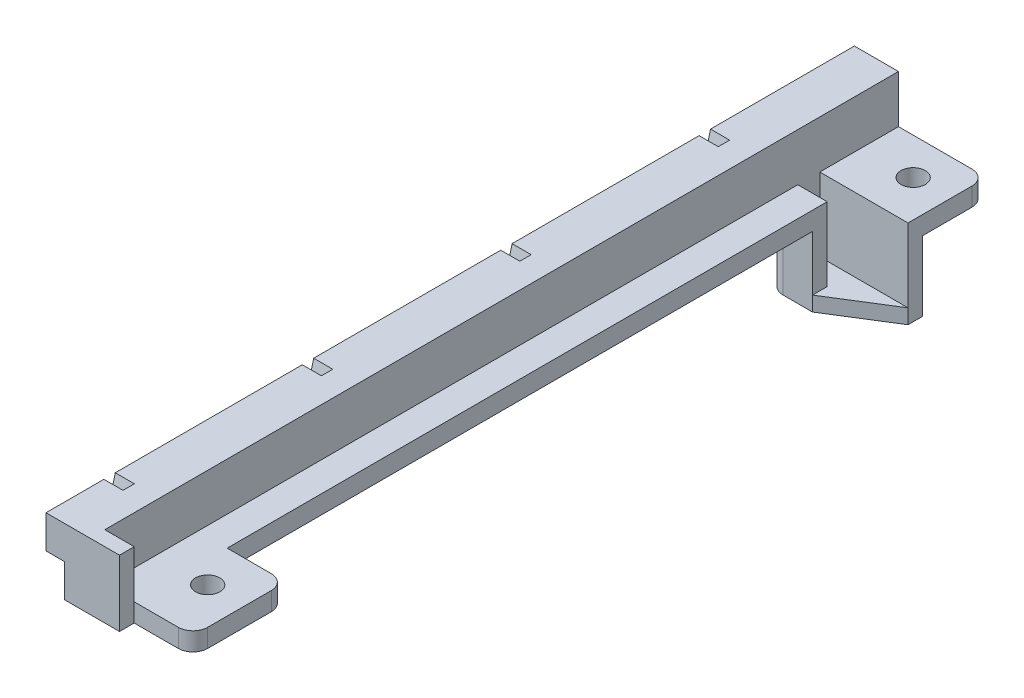
from build123d import *

# Parameters (mm, degrees)
SIDE_LIP_MAIN_SECTION_W          = 6
SIDE_LIP_MAIN_SECTION_H          = 108
SIDE_LIP_DEPTH                   = 5
VERTICAL_FIN_CUTS_DEPTH          = 2.6
SKETCH4_W                        = 3.5
SKETCH4_H                        = 108
DESCENDER_DEPTH                  = 4.5
SKETCH5_W                        = 108
SKETCH5_H                        = 2.5
PCB_BASE_DEPTH                   = 4
LOWER_CAP_DEPTH                  = 2
SKETCH9_W                        = 3
SKETCH9_H                        = 2.5
AL_BAR_CUT_DEPTH                 = 4
SKETCH10_W                       = 12.653731328
SKETCH10_H                       = 2.5
SKETCH10_W_2                     = 10.7
SUPPORT_TABS_DEPTH               = 8
BOLT_HOLES_REACH                 = 113.683
SKETCH11_R                       = 1.65
AL_BAR_ENCLOSURE_DEPTH           = 7.5
AL_BAR_BASE_DEPTH                = 2
FILLET1_R                        = 2
SKETCH16_W                       = 10
SKETCH16_H                       = 0.5
REDUCE_SIDE_SUPPORT_HEIGHT_DEPTH = 114.070774296


with BuildPart() as part:
    # Side lip main section → Side lip (new body)
    with BuildSketch(Plane(origin=(0, 0, 0), x_dir=(1, 0, 0), z_dir=(0, 1, 0))):
        with Locations((3, -54)):
            Rectangle(SIDE_LIP_MAIN_SECTION_W, SIDE_LIP_MAIN_SECTION_H)
    extrude(amount=-SIDE_LIP_DEPTH)

    # Sketch2 → Vertical fin cuts (cut)
    with BuildSketch(Plane.ZY):
        Polygon((102, 0), (103.246640014, -5), (101.70071957, -5), (100.454079556, 0), align=None)
        Polygon((75, 0), (76.246640014, -5), (74.70071957, -5), (73.454079556, 0), align=None)
        Polygon((48, 0), (49.246640014, -5), (47.70071957, -5), (46.454079556, 0), align=None)
        Polygon((21, 0), (22.246640014, -5), (20.70071957, -5), (19.454079556, 0), align=None)
    extrude(amount=-VERTICAL_FIN_CUTS_DEPTH, mode=Mode.SUBTRACT)

    # Sketch4 → Descender (add)
    with BuildSketch(Plane.XZ.offset(5)):
        with Locations((4.25, 54)):
            Rectangle(SKETCH4_W, SKETCH4_H)
    extrude(amount=DESCENDER_DEPTH)

    # Sketch5 → PCB base (add)
    with BuildSketch(Plane(origin=(6, 0, 0), x_dir=(0, 0, -1), z_dir=(1, 0, 0))):
        with Locations((-54, -8.25)):
            Rectangle(SKETCH5_W, SKETCH5_H)
    extrude(amount=PCB_BASE_DEPTH)

    # Sketch8 → Lower cap (add)
    with BuildSketch(Plane.XY.offset(108)):
        Polygon((6, 0), (10, 0), (10, -7), (10, -9.5), (2.5, -9.5), (2.5, -5), (0, -5), (0, 0), align=None)
    extrude(amount=LOWER_CAP_DEPTH)

    # Sketch9 → Al bar cut (cut)
    with BuildSketch(Plane(origin=(10, 0, 0), x_dir=(0, 0, -1), z_dir=(1, 0, 0))):
        with Locations((-12.2, -8.25)):
            Rectangle(SKETCH9_W, SKETCH9_H)
    extrude(amount=-AL_BAR_CUT_DEPTH, mode=Mode.SUBTRACT)

    # Sketch10 → Support tabs (add)
    with BuildSketch(Plane(origin=(10, 0, 0), x_dir=(0, 0, -1), z_dir=(1, 0, 0))):
        with Locations((-101.673134336, -8.25)):
            Rectangle(SKETCH10_W, SKETCH10_H)
        with Locations((-5.35, -8.25)):
            Rectangle(SKETCH10_W_2, SKETCH10_H)
    extrude(amount=SUPPORT_TABS_DEPTH)

    # Sketch11 → Bolt holes (cut, up to next)
    with BuildSketch(Plane(origin=(0, -7, 0), x_dir=(1, 0, 0), z_dir=(0, 1, 0)), mode=Mode.PRIVATE) as bolt_holes_sk1:
        with Locations((13, -5)):
            Circle(SKETCH11_R)
    bolt_holes_tool1 = extrude(bolt_holes_sk1.sketch, amount=-BOLT_HOLES_REACH, mode=Mode.PRIVATE) & part.part
    # Sketch11 → Bolt holes (cut, up to next)
    with BuildSketch(Plane(origin=(0, -7, 0), x_dir=(1, 0, 0), z_dir=(0, 1, 0)), mode=Mode.PRIVATE) as bolt_holes_sk2:
        with Locations((13, -101)):
            Circle(SKETCH11_R)
    bolt_holes_tool2 = extrude(bolt_holes_sk2.sketch, amount=-BOLT_HOLES_REACH, mode=Mode.PRIVATE) & part.part
    add(bolt_holes_tool1.solids().sort_by_distance((13, -7, 5))[0], mode=Mode.SUBTRACT)
    add(bolt_holes_tool2.solids().sort_by_distance((13, -7, 101))[0], mode=Mode.SUBTRACT)

    # Sketch12 → Al bar enclosure (add)
    with BuildSketch(Plane.XZ.offset(9.5)):
        Polygon((6, 10.7), (18, 10.7), (18, 8.7), (4, 8.7), (4, 15.7), (10, 15.7), (10, 13.7), (6, 13.7), align=None)
    extrude(amount=AL_BAR_ENCLOSURE_DEPTH)

    # Sketch13 → Al bar base (add)
    with BuildSketch(Plane.XZ.offset(17)):
        Polygon((10, 15.7), (4, 15.7), (4, 8.7), (18, 8.7), (18, 10.7), align=None)
    extrude(amount=AL_BAR_BASE_DEPTH)

    # Fillet1
    fillet1_edges = [part.edges().sort_by_distance(p)[0] for p in [
        (4, -14.25, 8.7),
        (4, -14.25, 15.7),
        (18, -8.25, 95.346268672),
        (18, -8.25, 108),
        (18, -8.25, 0),
    ]]
    fillet(fillet1_edges, radius=FILLET1_R)

    # Sketch16 → Reduce side support height (cut, through all)
    with BuildSketch(Plane.XY.offset(110)):
        with Locations((5, -0.25)):
            Rectangle(SKETCH16_W, SKETCH16_H)
    extrude(amount=-REDUCE_SIDE_SUPPORT_HEIGHT_DEPTH, mode=Mode.SUBTRACT)


solid = part.part
